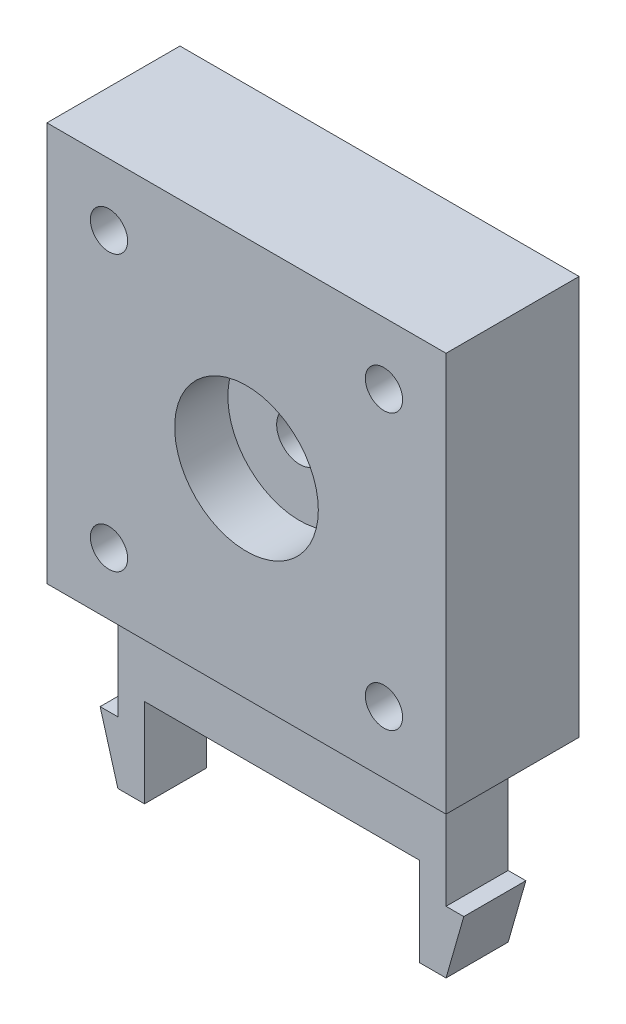
from build123d import *

# Parameters (mm, degrees)
SKETCH1_W           = 45
SKETCH1_H           = 45
SKETCH1_R           = 2.6
BOSS_EXTRUDE1_DEPTH = 7.5
SKETCH2_R           = 8.1
CUT_EXTRUDE1_DEPTH  = 6
CUT_EXTRUDE4_START  = -6
SKETCH5_R           = 8.1
CUT_EXTRUDE4_DEPTH  = 6
SKETCH7_W           = 37
SKETCH7_H           = 7
BOSS_EXTRUDE2_DEPTH = 10
CUT_EXTRUDE6_START  = 2
CUT_EXTRUDE6_DEPTH  = 3.6
SKETCH8_R           = 2.1
CUT_EXTRUDE7_DEPTH  = 43.278836313
SKETCH9_W           = 3
SKETCH9_H           = 7
BOSS_EXTRUDE3_DEPTH = 10
SKETCH10_W          = 7
SKETCH10_H          = 7
BOSS_EXTRUDE4_DEPTH = 2
CHAMFER2_SIZE2      = 7
CHAMFER2_SIZE       = 2
CHAMFER3_SIZE2      = 7
CHAMFER3_SIZE       = 2


with BuildPart() as part:
    # Sketch1 → Boss-Extrude1 (new, symmetric)
    with BuildSketch(Plane.XY):
        Rectangle(SKETCH1_W, SKETCH1_H)
        Circle(SKETCH1_R, mode=Mode.SUBTRACT)
    extrude(amount=BOSS_EXTRUDE1_DEPTH, both=True)

    # Sketch2 → Cut-Extrude1 (cut)
    with BuildSketch(Plane.XY.offset(7.5)):
        Circle(SKETCH2_R)
    extrude(amount=-CUT_EXTRUDE1_DEPTH, mode=Mode.SUBTRACT)

    # Sketch5 → Cut-Extrude4 (cut)
    with BuildSketch(Plane(origin=(0, 0, -7.5), x_dir=(-1, 0, 0), z_dir=(0, 0, -1)).offset(CUT_EXTRUDE4_START)):
        with Locations(Location((0, 0, 0), (0, 0, 180))):
            Circle(SKETCH5_R)
    extrude(amount=CUT_EXTRUDE4_DEPTH, mode=Mode.SUBTRACT)

    # Sketch7 → Boss-Extrude2 (add)
    with BuildSketch(Plane.XZ.offset(22.5)):
        Rectangle(SKETCH7_W, SKETCH7_H)
    extrude(amount=BOSS_EXTRUDE2_DEPTH)

    # Sketch6 → Cut-Extrude6 (cut)
    with BuildSketch(Plane.XY.offset(-7.5).offset(CUT_EXTRUDE6_START)):
        Polygon((19.2, 17.636195996), (15.5, 19.772391992), (11.8, 17.636195996), (11.8, 13.363804004), (15.5, 11.227608008), (19.2, 13.363804004), align=None)
        Polygon((-11.8, 17.636195996), (-15.5, 19.772391992), (-19.2, 17.636195996), (-19.2, 13.363804004), (-15.5, 11.227608008), (-11.8, 13.363804004), align=None)
        Polygon((19.2, -13.363804004), (15.5, -11.227608008), (11.8, -13.363804004), (11.8, -17.636195996), (15.5, -19.772391992), (19.2, -17.636195996), align=None)
        Polygon((-11.8, -13.363804004), (-15.5, -11.227608008), (-19.2, -13.363804004), (-19.2, -17.636195996), (-15.5, -19.772391992), (-11.8, -17.636195996), align=None)
    extrude(amount=CUT_EXTRUDE6_DEPTH, mode=Mode.SUBTRACT)

    # Sketch8 → Cut-Extrude7 (cut, through all)
    with BuildSketch(Plane(origin=(0, 0, -7.5), x_dir=(-1, 0, 0), z_dir=(0, 0, -1))):
        with Locations((-15.5, 15.5)):
            Circle(SKETCH8_R)
        with Locations((15.5, 15.5)):
            Circle(SKETCH8_R)
        with Locations((15.5, -15.5)):
            Circle(SKETCH8_R)
        with Locations((-15.5, -15.5)):
            Circle(SKETCH8_R)
    extrude(amount=-CUT_EXTRUDE7_DEPTH, mode=Mode.SUBTRACT)

    # Sketch9 → Boss-Extrude3 (add)
    with BuildSketch(Plane.XZ.offset(32.5)):
        with Locations((-17, 0)):
            Rectangle(SKETCH9_W, SKETCH9_H)
        with Locations((17, 0)):
            Rectangle(SKETCH9_W, SKETCH9_H)
    extrude(amount=BOSS_EXTRUDE3_DEPTH)

    # Sketch10 → Boss-Extrude4 (add)
    with BuildSketch(Plane.ZY.offset(18.5)):
        with Locations((0, -39)):
            Rectangle(SKETCH10_W, SKETCH10_H)
    boss_extrude4 = extrude(amount=BOSS_EXTRUDE4_DEPTH)

    # Mirror1: Boss-Extrude4 across plane
    add(boss_extrude4.mirror(Plane(origin=(0, 0, 0), x_dir=(0, 0, 1), z_dir=(1, 0, 0))))

    # Chamfer2
    chamfer2_edges = [part.edges().sort_by_distance(p)[0] for p in [
        (-20.5, -42.5, 0),
    ]]
    chamfer2_side = [part.faces().sort_by_distance(p)[0] for p in [
        (-20.46, -42.5, 0),
    ]]
    chamfer(chamfer2_edges, length=CHAMFER2_SIZE - 0.0001, length2=CHAMFER2_SIZE2 - 0.0001, reference=chamfer2_side[0])  # a hair under: the kernel refuses the full size

    # Chamfer3
    chamfer3_edges = [part.edges().sort_by_distance(p)[0] for p in [
        (20.5, -42.5, 0),
    ]]
    chamfer3_side = [part.faces().sort_by_distance(p)[0] for p in [
        (20.46, -42.5, 0),
    ]]
    chamfer(chamfer3_edges, length=CHAMFER3_SIZE - 0.0001, length2=CHAMFER3_SIZE2 - 0.0001, reference=chamfer3_side[0])  # a hair under: the kernel refuses the full size


solid = part.part
